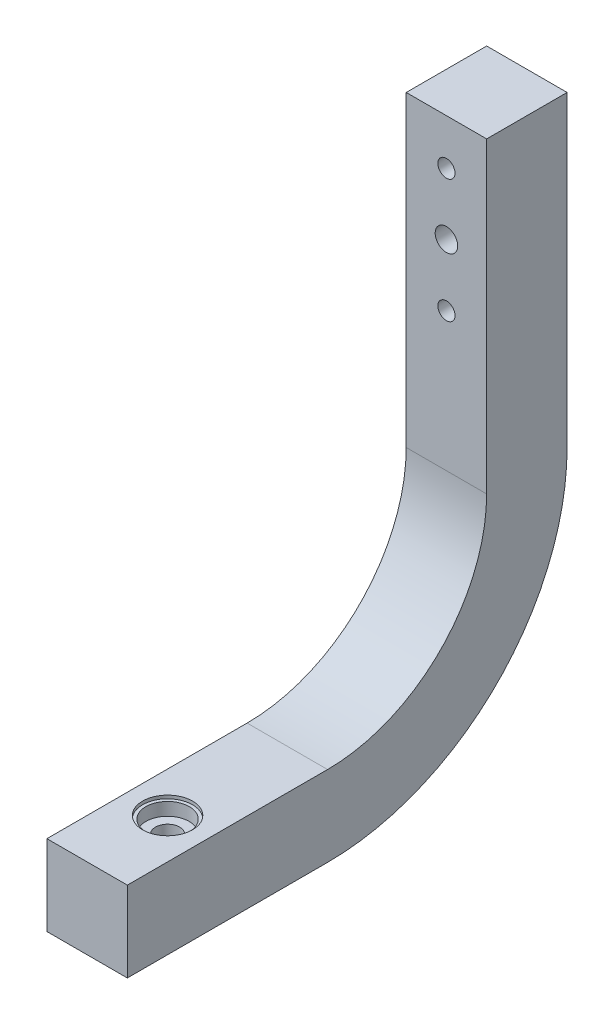
from build123d import *

# Parameters (mm, degrees)
BOSS_EXTRUDE1_DEPTH      = 7.5
BOSS_EXTRUDE1_DEPTH_BACK = 7.5
SKETCH3_R                = 2.25
CUT_EXTRUDE1_DEPTH       = 120.788355027
CUT_EXTRUDE2_DEPTH       = 107.156723763
CUT_EXTRUDE2_DEPTH_BACK  = 107.156723763
SKETCH4_R                = 2.1
SKETCH4_R_2              = 1.6


with BuildPart() as part:
    # Sketch1 → Boss-Extrude1 (new, two sides: drawn at the far end of the back side and taken through both)
    with BuildSketch(Plane(origin=(0, 0, 0), x_dir=(0, 0, -1), z_dir=(1, 0, 0)).offset(-BOSS_EXTRUDE1_DEPTH_BACK)):
        with BuildLine():
            Line((-15, 20), (0, 20))
            Line((0, 20), (0, -37.333333333))
            ThreePointArc((0, -37.333333333), (-13.082563774, -68.917436226), (-44.666666667, -82))
            Line((-44.666666667, -82), (-67, -82))
            Line((-67, -82), (-82, -82))
            Line((-82, -82), (-82, -67))
            Line((-82, -67), (-67, -67))
            Line((-67, -67), (-44.666666667, -67))
            ThreePointArc((-44.666666667, -67), (-23.689165491, -58.310834509), (-15, -37.333333333))
            Line((-15, -37.333333333), (-15, 20))
        make_face()
    extrude(amount=BOSS_EXTRUDE1_DEPTH + BOSS_EXTRUDE1_DEPTH_BACK)

    # Sketch3 → Cut-Extrude1 (cut, through all)
    with BuildSketch(Plane(origin=(0, -67, 0), x_dir=(1, 0, 0), z_dir=(0, 1, 0))):
        with Locations((0, -67)):
            Circle(SKETCH3_R)
    extrude(amount=-CUT_EXTRUDE1_DEPTH, mode=Mode.SUBTRACT)

    # Sketch4 → Cut-Extrude2 (cut, two sides: drawn at the far end of the back side and taken through both)
    with BuildSketch(Plane.XY.offset(15).offset(-CUT_EXTRUDE2_DEPTH_BACK)):
        Circle(SKETCH4_R)
        with Locations((0, 11.5)):
            Circle(SKETCH4_R_2)
        with Locations((0, -11.5)):
            Circle(SKETCH4_R_2)
    extrude(amount=CUT_EXTRUDE2_DEPTH + CUT_EXTRUDE2_DEPTH_BACK, mode=Mode.SUBTRACT)

    # Sketch5 → Cut-Revolve1 (revolve, cut)
    with BuildSketch(Plane(origin=(0, 0, 0), x_dir=(0, 0, -1), z_dir=(1, 0, 0))):
        Polygon((-62.95, -79), (-62.95, -81.4), (-62.35, -81.4), (-62.35, -82), (-67, -82), (-67, -79), align=None)
        Polygon((-67, -70), (-62.95, -70), (-62.95, -67.6), (-62.35, -67.6), (-62.35, -67), (-67, -67), align=None)
    revolve(axis=Axis((0, -52.364154311, 67), (0, 1, 0)), mode=Mode.SUBTRACT)


solid = part.part
